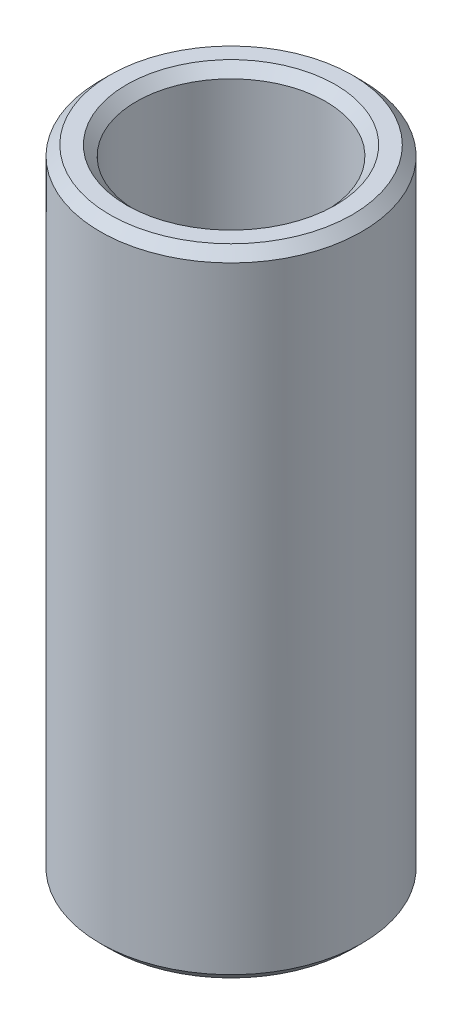
from build123d import *

# Parameters (mm, degrees)
SKETCH1_R           = 42.5
BOSS_EXTRUDE1_DEPTH = 206.517811158
SKETCH2_R           = 30.756503778
CUT_EXTRUDE1_DEPTH  = 216.08627647
CHAMFER1_SIZE       = 3.163068667


with BuildPart() as part:
    # Sketch1 → Boss-Extrude1 (new body)
    with BuildSketch(Plane(origin=(0, 0, 0), x_dir=(1, 0, 0), z_dir=(0, 1, 0))):
        Circle(SKETCH1_R)
    extrude(amount=BOSS_EXTRUDE1_DEPTH)

    # Sketch2 → Cut-Extrude1 (cut, through all)
    with BuildSketch(Plane(origin=(0, 0, 0), x_dir=(1, 0, 0), z_dir=(0, 1, 0))):
        Circle(SKETCH2_R)
    extrude(amount=CUT_EXTRUDE1_DEPTH, mode=Mode.SUBTRACT)

    # Chamfer1
    chamfer1_edges = [part.edges().sort_by_distance(p)[0] for p in [
        (-30.756503778, 206.517811158, 0),
        (-30.756503778, 0, 0),
        (-42.5, 0, 0),
        (-42.5, 206.517811158, 0),
    ]]
    chamfer(chamfer1_edges, length=CHAMFER1_SIZE)


solid = part.part
